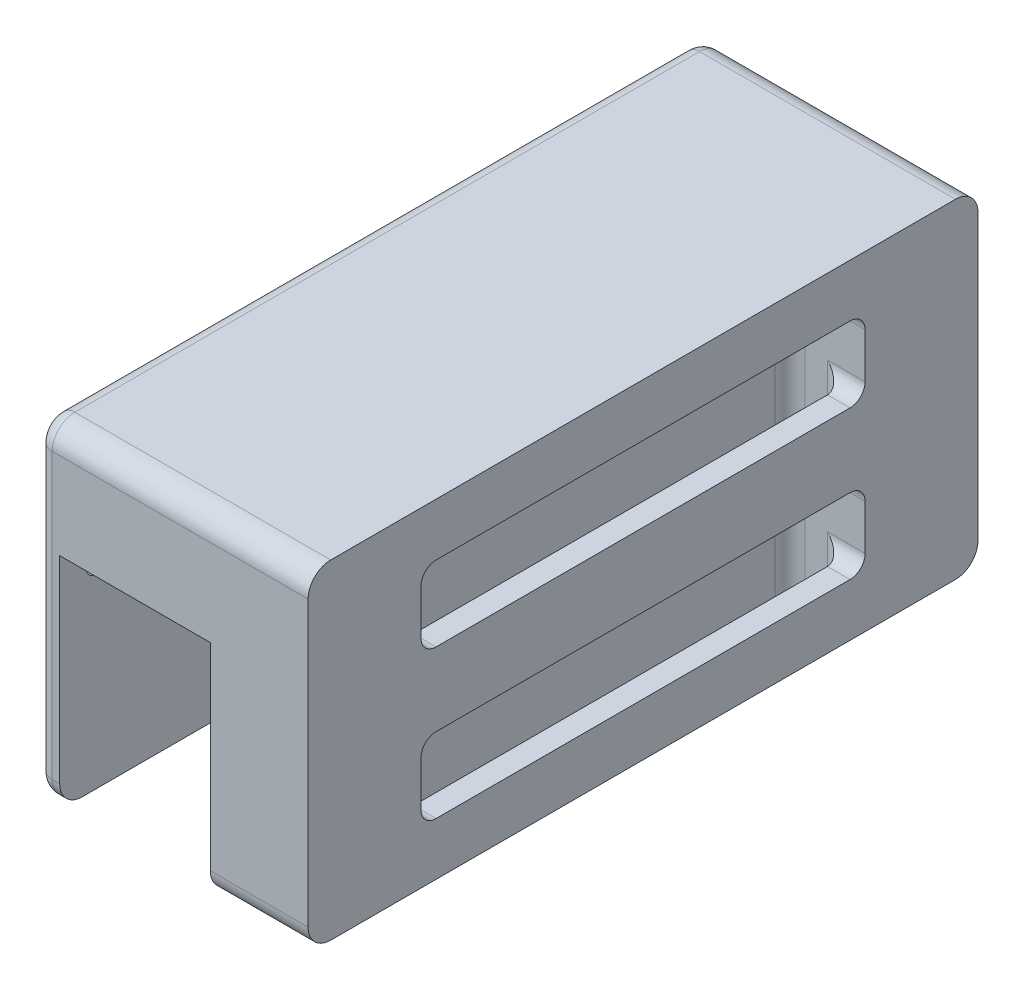
from build123d import *

# Parameters (mm, degrees)
RESSALTO_EXTRUS_O2_DEPTH      = 30
RESSALTO_EXTRUS_O3_START      = 3
RESSALTO_EXTRUS_O3_DEPTH      = 3
RESSALTO_EXTRUS_O4_DEPTH      = 3
RESSALTO_EXTRUS_O4_DEPTH_BACK = 10
CORTE_EXTRUS_O1_DEPTH         = 10
CORTE_EXTRUS_O2_REACH         = 83.702
FILETE1_START                 = -19.773073923
FILETE1_DEPTH                 = 36.75
FILETE1_START_2               = -13.40159992
FILETE1_2_DEPTH               = 59
ESBO_O10_R                    = 1.5
CORTE_EXTRUS_O3_DEPTH         = 10
CORTE_EXTRUS_O4_DEPTH         = 10
FILETE2_R                     = 2
ESBO_O13_R                    = 1.5
CORTE_EXTRUS_O5_DEPTH         = 16


with BuildPart() as part:
    # Esboço2 → Ressalto-extrusão2 (new body)
    with BuildSketch(Plane(origin=(0, 0, 0), x_dir=(0, 0, -1), z_dir=(1, 0, 0))):
        with BuildLine():
            Line((2.90159992, -0.062465938), (-35.09840008, -0.062465938))
            Line((-35.09840008, -0.062465938), (-39.886084903, -0.062465938))
            ThreePointArc((-39.886084903, -0.062465938), (-45.202180234, 1.467638524), (-48.891439328, 5.589707975))
            ThreePointArc((-48.891439328, 5.589707975), (-52.096536948, 9.772081499), (-56.69840008, 12.338743681))
            ThreePointArc((-56.69840008, 12.338743681), (-59.373224015, 11.895603401), (-60.59840008, 9.476926077))
            Line((-60.59840008, 9.476926077), (-60.59840008, 20.976926077))
            ThreePointArc((-60.59840008, 20.976926077), (-59.719720424, 23.09824642), (-57.59840008, 23.976926077))
            Line((-57.59840008, 23.976926077), (25.40159992, 23.976926077))
            ThreePointArc((25.40159992, 23.976926077), (27.522920263, 23.09824642), (28.40159992, 20.976926077))
            Line((28.40159992, 20.976926077), (28.40159992, 9.476926077))
            ThreePointArc((28.40159992, 9.476926077), (27.176423855, 11.895603401), (24.50159992, 12.338743681))
            ThreePointArc((24.50159992, 12.338743681), (19.899736788, 9.772081499), (16.694639168, 5.589707975))
            ThreePointArc((16.694639168, 5.589707975), (13.005380073, 1.467638524), (7.689284743, -0.062465938))
            Line((7.689284743, -0.062465938), (2.90159992, -0.062465938))
        make_face()
    extrude(amount=RESSALTO_EXTRUS_O2_DEPTH)

    # Esboço3 → Ressalto-extrusão3 (add)
    with BuildSketch(Plane.ZY.offset(RESSALTO_EXTRUS_O3_START)):
        with BuildLine():
            Line((60.59840008, 15.226926077), (60.59840008, 20.976926077))
            ThreePointArc((60.59840008, 20.976926077), (59.719720424, 23.09824642), (57.59840008, 23.976926077))
            Line((57.59840008, 23.976926077), (16.09840008, 23.976926077))
            Line((16.09840008, 23.976926077), (-25.40159992, 23.976926077))
            ThreePointArc((-25.40159992, 23.976926077), (-27.522920263, 23.09824642), (-28.40159992, 20.976926077))
            Line((-28.40159992, 20.976926077), (-28.40159992, 15.226926077))
            Line((-28.40159992, 15.226926077), (-28.40159992, -16.773073923))
            ThreePointArc((-28.40159992, -16.773073923), (-27.522920263, -18.894394267), (-25.40159992, -19.773073923))
            Line((-25.40159992, -19.773073923), (57.59840008, -19.773073923))
            ThreePointArc((57.59840008, -19.773073923), (59.719720424, -18.894394267), (60.59840008, -16.773073923))
            Line((60.59840008, -16.773073923), (60.59840008, 15.226926077))
        make_face()
    extrude(amount=-RESSALTO_EXTRUS_O3_DEPTH)

    # Esboço4 → Ressalto-extrusão4 (add, two sides: drawn at the far end of the back side and taken through both)
    with BuildSketch(Plane(origin=(30, 0, 0), x_dir=(0, 0, -1), z_dir=(1, 0, 0)).offset(-RESSALTO_EXTRUS_O4_DEPTH_BACK)):
        with BuildLine():
            Line((-16.09840008, 23.976926077), (25.40159992, 23.976926077))
            ThreePointArc((25.40159992, 23.976926077), (27.522920263, 23.09824642), (28.40159992, 20.976926077))
            Line((28.40159992, 20.976926077), (28.40159992, 15.226926077))
            Line((28.40159992, 15.226926077), (28.40159992, -16.773073923))
            ThreePointArc((28.40159992, -16.773073923), (27.522920263, -18.894394267), (25.40159992, -19.773073923))
            Line((25.40159992, -19.773073923), (-57.59840008, -19.773073923))
            ThreePointArc((-57.59840008, -19.773073923), (-59.719720424, -18.894394267), (-60.59840008, -16.773073923))
            Line((-60.59840008, -16.773073923), (-60.59840008, 15.226926077))
            Line((-60.59840008, 15.226926077), (-60.59840008, 20.976926077))
            ThreePointArc((-60.59840008, 20.976926077), (-59.719720424, 23.09824642), (-57.59840008, 23.976926077))
            Line((-57.59840008, 23.976926077), (-16.09840008, 23.976926077))
        make_face()
    extrude(amount=RESSALTO_EXTRUS_O4_DEPTH + RESSALTO_EXTRUS_O4_DEPTH_BACK)

    # Esboço8 → Corte-extrusão1 (cut)
    with BuildSketch(Plane(origin=(33, 0, 0), x_dir=(0, 0, -1), z_dir=(1, 0, 0))):
        with BuildLine():
            Line((-43.59840008, -2.773073923), (11.40159992, -2.773073923))
            ThreePointArc((11.40159992, -2.773073923), (12.815813482, -3.358860361), (13.40159992, -4.773073923))
            Line((13.40159992, -4.773073923), (13.40159992, -10.773073923))
            ThreePointArc((13.40159992, -10.773073923), (12.815813482, -12.187287486), (11.40159992, -12.773073923))
            Line((11.40159992, -12.773073923), (-43.59840008, -12.773073923))
            ThreePointArc((-43.59840008, -12.773073923), (-45.012613643, -12.187287486), (-45.59840008, -10.773073923))
            Line((-45.59840008, -10.773073923), (-45.59840008, -4.773073923))
            ThreePointArc((-45.59840008, -4.773073923), (-45.012613643, -3.358860361), (-43.59840008, -2.773073923))
        make_face()
        with BuildLine():
            Line((-43.59840008, 6.976926077), (11.40159992, 6.976926077))
            ThreePointArc((11.40159992, 6.976926077), (12.815813482, 7.562712514), (13.40159992, 8.976926077))
            Line((13.40159992, 8.976926077), (13.40159992, 14.976926077))
            ThreePointArc((13.40159992, 14.976926077), (12.815813482, 16.391139639), (11.40159992, 16.976926077))
            Line((11.40159992, 16.976926077), (-43.59840008, 16.976926077))
            ThreePointArc((-43.59840008, 16.976926077), (-45.012613643, 16.391139639), (-45.59840008, 14.976926077))
            Line((-45.59840008, 14.976926077), (-45.59840008, 8.976926077))
            ThreePointArc((-45.59840008, 8.976926077), (-45.012613643, 7.562712514), (-43.59840008, 6.976926077))
        make_face()
    extrude(amount=-CORTE_EXTRUS_O1_DEPTH, mode=Mode.SUBTRACT)

    # Corte-extrusão2: up to this face of the body (flat: up to its plane)
    corte_extrus_o2_end = Plane(part.part.faces().sort_by_distance((28, 16.976926077, 16.09840008))[0])
    # Esboço9 → Corte-extrusão2 (cut, up to the picked face)
    with BuildSketch(Plane(origin=(0, -19.773073923, 0), x_dir=(-1, 0, 0), z_dir=(0, -1, 0)), mode=Mode.PRIVATE) as corte_extrus_o2_sk1:
        with BuildLine():
            Line((-25, 13.40159992), (-28, 13.40159992))
            ThreePointArc((-28, 13.40159992), (-29.414213562, 12.815813482), (-30, 11.40159992))
            Line((-30, 11.40159992), (-30, -43.59840008))
            ThreePointArc((-30, -43.59840008), (-29.414213562, -45.012613643), (-28, -45.59840008))
            Line((-28, -45.59840008), (-25, -45.59840008))
            ThreePointArc((-25, -45.59840008), (-23.585786438, -45.012613643), (-23, -43.59840008))
            Line((-23, -43.59840008), (-23, 11.40159992))
            ThreePointArc((-23, 11.40159992), (-23.585786438, 12.815813482), (-25, 13.40159992))
        make_face()
    corte_extrus_o2_tool1 = split(extrude(corte_extrus_o2_sk1.sketch, amount=-CORTE_EXTRUS_O2_REACH, mode=Mode.PRIVATE), bisect_by=corte_extrus_o2_end, keep=Keep.BOTH, mode=Mode.PRIVATE)
    add(corte_extrus_o2_tool1.solids().sort_by(Axis((26.5, -19.773074, 16.0984), (0, 1, 0)))[0], mode=Mode.SUBTRACT)

    # Filete1: read off the stored shape, not the designer's step
    # Filete1 outline → Filete1 (add)
    with BuildSketch(Plane(origin=(0, 0, 0), x_dir=(1, 0, 0), z_dir=(0, 1, 0)).offset(FILETE1_START)):
        with BuildLine():
            ThreePointArc((25, -45.59840008), (23.585786437, -45.012613642), (23, -43.59840008))
            Line((23, -43.59840008), (23, -45.59840008))
            Line((23, -45.59840008), (25, -45.59840008))
        make_face()
        with BuildLine():
            ThreePointArc((23, 11.40159992), (23.585786438, 12.815813482), (25, 13.40159992))
            Line((25, 13.40159992), (23, 13.40159992))
            Line((23, 13.40159992), (23, 11.40159992))
        make_face()
    extrude(amount=FILETE1_DEPTH)

    # Filete1 2 outline → Filete1 2 (add)
    with BuildSketch(Plane.XY.offset(FILETE1_START_2)):
        with BuildLine():
            ThreePointArc((23, 14.976926077), (23.585786438, 16.391139639), (25, 16.976926077))
            Line((25, 16.976926077), (23, 16.976926077))
            Line((23, 16.976926077), (23, 14.976926077))
        make_face()
    extrude(amount=FILETE1_2_DEPTH)

    # Esboço10 → Corte-extrusão3 (cut)
    with BuildSketch(Plane(origin=(0, 0, 0), x_dir=(0, 0, -1), z_dir=(1, 0, 0))):
        with Locations((-55.59840008, 6.338743681)):
            Circle(ESBO_O10_R)
        with Locations((23.40159992, 6.338743681)):
            Circle(ESBO_O10_R)
        with Locations((-16.09840008, -8.562465938)):
            Circle(ESBO_O10_R)
    extrude(amount=-CORTE_EXTRUS_O3_DEPTH, mode=Mode.SUBTRACT)

    # Esboço12 → Corte-extrusão4 (cut)
    with BuildSketch(Plane(origin=(0, 0, 0), x_dir=(0, 0, -1), z_dir=(1, 0, 0))):
        with BuildLine():
            Line((-31.59840008, -2.862465938), (-25.59840008, -2.862465938))
            ThreePointArc((-25.59840008, -2.862465938), (-24.184186518, -3.448252375), (-23.59840008, -4.862465938))
            Line((-23.59840008, -4.862465938), (-23.59840008, -14.773073923))
            ThreePointArc((-23.59840008, -14.773073923), (-24.184186518, -16.187287486), (-25.59840008, -16.773073923))
            Line((-25.59840008, -16.773073923), (-31.59840008, -16.773073923))
            ThreePointArc((-31.59840008, -16.773073923), (-33.012613643, -16.187287486), (-33.59840008, -14.773073923))
            Line((-33.59840008, -14.773073923), (-33.59840008, -4.862465938))
            ThreePointArc((-33.59840008, -4.862465938), (-33.012613643, -3.448252375), (-31.59840008, -2.862465938))
        make_face()
        with BuildLine():
            Line((-6.59840008, -2.862465938), (-0.59840008, -2.862465938))
            ThreePointArc((-0.59840008, -2.862465938), (0.815813482, -3.448252375), (1.40159992, -4.862465938))
            Line((1.40159992, -4.862465938), (1.40159992, -14.773073923))
            ThreePointArc((1.40159992, -14.773073923), (0.815813482, -16.187287486), (-0.59840008, -16.773073923))
            Line((-0.59840008, -16.773073923), (-6.59840008, -16.773073923))
            ThreePointArc((-6.59840008, -16.773073923), (-8.012613643, -16.187287486), (-8.59840008, -14.773073923))
            Line((-8.59840008, -14.773073923), (-8.59840008, -4.862465938))
            ThreePointArc((-8.59840008, -4.862465938), (-8.012613643, -3.448252375), (-6.59840008, -2.862465938))
        make_face()
    extrude(amount=-CORTE_EXTRUS_O4_DEPTH, mode=Mode.SUBTRACT)

    # Filete2
    filete2_edges = [part.edges().sort_by_distance(p)[0] for p in [
        (-3, 2.101926077, 60.59840008),
        (-3, 23.09824642, 59.719720424),
        (-3, 23.976926077, 16.09840008),
        (-3, 23.09824642, -27.522920263),
        (-3, 2.101926077, -28.40159992),
        (-3, -18.894394267, -27.522920263),
        (-3, -19.773073923, 16.09840008),
        (-3, -18.894394267, 59.719720424),
    ]]
    fillet(filete2_edges, radius=FILETE2_R)

    # Esboço13 → Corte-extrusão5 (cut)
    with BuildSketch(Plane.ZY.offset(3)):
        with Locations((27.44840008, 3.976926077)):
            Circle(ESBO_O13_R)
        with Locations((4.74840008, 3.976926077)):
            Circle(ESBO_O13_R)
    extrude(amount=-CORTE_EXTRUS_O5_DEPTH, mode=Mode.SUBTRACT)


solid = part.part
